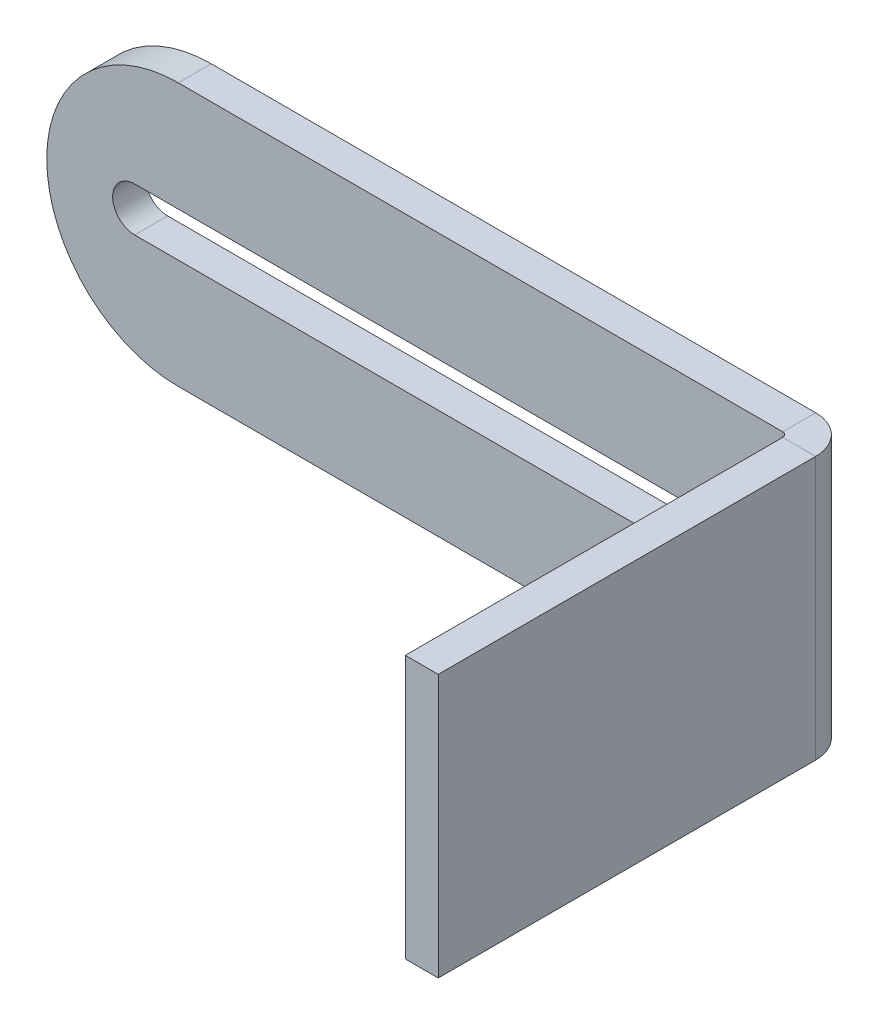
from build123d import *

# Parameters (mm, degrees)
SKETCH1_W                    = 117.4
SKETCH1_H                    = 39.9
BASE_FLANGE1_DEPTH           = 5
EDGE_FLANGE1_STRIP_W         = 21.4732
EDGE_FLANGE1_STRIP_H         = 5
EDGE_FLANGE1_STRIP_CUT_DEPTH = 39.9
EDGE_FLANGE1_DEPTH           = 39.9
CUT_EXTRUDE1_START           = -5
CUT_EXTRUDE1_DEPTH           = 5


with BuildPart() as part:
    # Base-Flange1: sheet metal written as solids
    # Sketch1 → Base-Flange1 (new body)
    with BuildSketch(Plane.XY):
        Rectangle(SKETCH1_W, SKETCH1_H)
    extrude(amount=-BASE_FLANGE1_DEPTH)

    # Edge-Flange1: sheet metal written as solids
    # Edge-Flange1 strip (on a plane across the edge) → Edge-Flange1 strip cut (cut)
    with BuildSketch(Plane(origin=(58.7, -19.95, 0), x_dir=(-1, 0, 0), z_dir=(0, 1, 0))):
        with Locations((-5, -2.5)):
            Rectangle(EDGE_FLANGE1_STRIP_W, EDGE_FLANGE1_STRIP_H)
    extrude(amount=EDGE_FLANGE1_STRIP_CUT_DEPTH, mode=Mode.SUBTRACT)

    # Edge-Flange1 section (on a plane across the edge) → Edge-Flange1 (add)
    with BuildSketch(Plane(origin=(58.7, -19.95, 0), x_dir=(-1, 0, 0), z_dir=(0, 1, 0))):
        with BuildLine():
            Line((0, 0.7366), (0, 58))
            Line((0, 58), (5, 58))
            Line((5, 58), (5, 0.7366))
            ThreePointArc((5, 0.7366), (5.215745145, 0.215745145), (5.7366, 0))
            Line((5.7366, 0), (5.7366, -5))
            ThreePointArc((5.7366, -5), (1.680211239, -3.319788761), (0, 0.7366))
        make_face()
    extrude(amount=EDGE_FLANGE1_DEPTH)

    # Cut-Extrude1: read off the stored shape, not the designer's step
    # Cut-Extrude1 outline → Cut-Extrude1 (cut)
    with BuildSketch(Plane.XY.offset(CUT_EXTRUDE1_START)):
        with BuildLine():
            ThreePointArc((-38.75, -19.95), (-52.856780317, -14.106780252), (-58.7, 9.1e-08))
            Line((-58.7, 9.1e-08), (-58.7, -19.95))
            Line((-58.7, -19.95), (-38.75, -19.95))
        make_face()
        with BuildLine():
            ThreePointArc((-58.7, 9.1e-08), (-52.856780252, 14.106780317), (-38.75, 19.95))
            Line((-38.75, 19.95), (-58.7, 19.95))
            Line((-58.7, 19.95), (-58.7, 9.1e-08))
        make_face()
        with BuildLine():
            ThreePointArc((42.85, -3.35), (46.2, 0), (42.85, 3.35))
            Line((42.85, 3.35), (-45.35, 3.35))
            ThreePointArc((-45.35, 3.35), (-48.7, 0), (-45.35, -3.35))
            Line((-45.35, -3.35), (42.85, -3.35))
        make_face()
    extrude(amount=CUT_EXTRUDE1_DEPTH, mode=Mode.SUBTRACT)


solid = part.part
